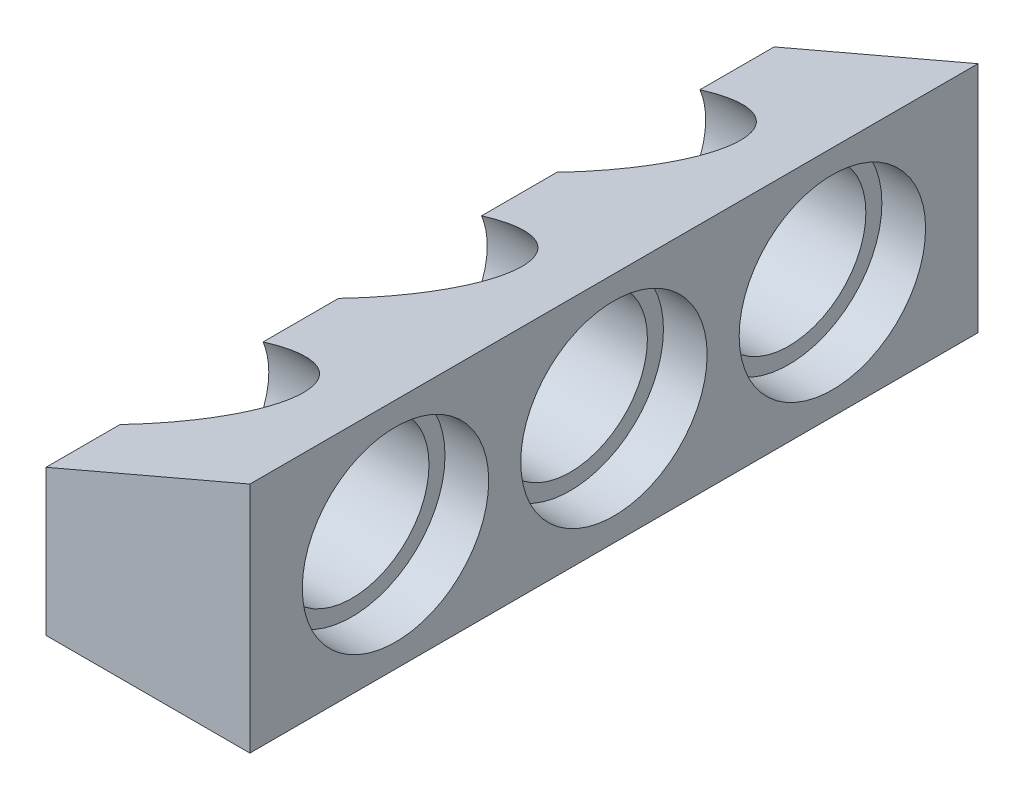
from build123d import *

# Parameters (mm, degrees)
BOSS_EXTRU_1_DEPTH      = 25
ESQUISSE2_R             = 2.65
ENL_V_MAT_EXTRU_1_DEPTH = 28.166155414
ESQUISSE3_R             = 3.2
ENL_V_MAT_EXTRU_2_DEPTH = 1.5


with BuildPart() as part:
    # Esquisse1 → Boss.-Extru.1 (new body)
    with BuildSketch(Plane.XY):
        Polygon((0, 0), (7, 0), (7, 8), (0, 5), align=None)
    extrude(amount=BOSS_EXTRU_1_DEPTH)

    # Esquisse2 → Enlèv. mat.-Extru.1 (cut, through all)
    with BuildSketch(Plane.ZY):
        with Locations((5, 4)):
            Circle(ESQUISSE2_R)
        with Locations((12.5, 4)):
            Circle(ESQUISSE2_R)
        with Locations((20, 4)):
            Circle(ESQUISSE2_R)
    extrude(amount=-ENL_V_MAT_EXTRU_1_DEPTH, mode=Mode.SUBTRACT)

    # Esquisse3 → Enlèv. mat.-Extru.2 (cut)
    with BuildSketch(Plane(origin=(7, 0, 0), x_dir=(0, 0, -1), z_dir=(1, 0, 0))):
        with Locations((-20, 4)):
            Circle(ESQUISSE3_R)
        with Locations((-12.5, 4)):
            Circle(ESQUISSE3_R)
        with Locations((-5, 4)):
            Circle(ESQUISSE3_R)
    extrude(amount=-ENL_V_MAT_EXTRU_2_DEPTH, mode=Mode.SUBTRACT)


solid = part.part
